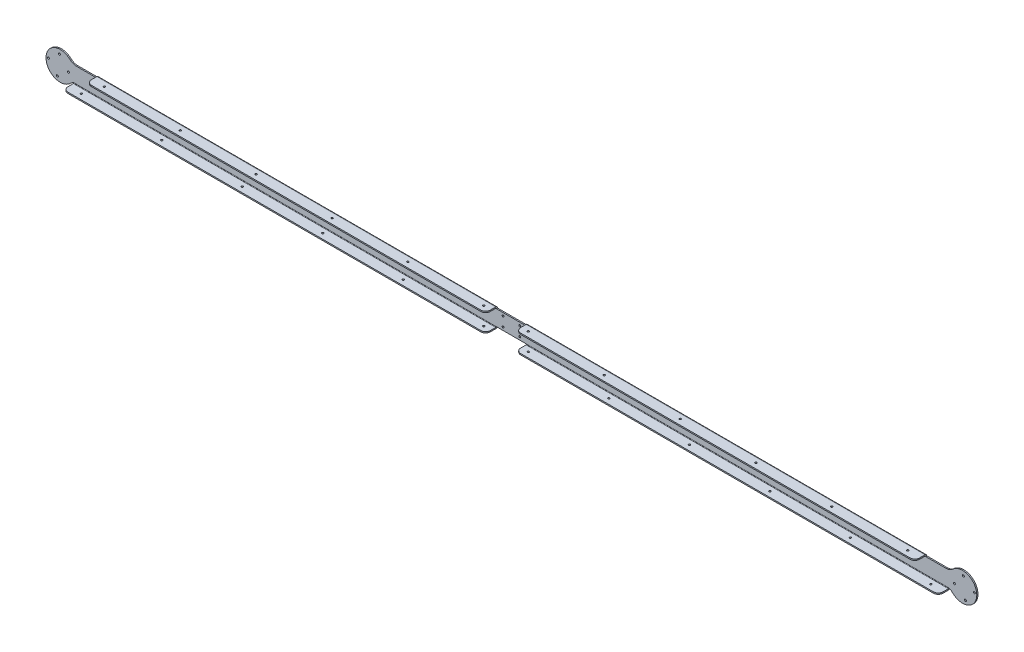
from build123d import *

# Parameters (mm, degrees)
SKETCH1_W                        = 2413
SKETCH1_H                        = 41.5544
BASE_FLANGE1_DEPTH               = 3.2639
SKETCH66_R                       = 38.1
BOSS_EXTRUDE1_DEPTH              = 3.2639
EDGE_FLANGE1_DEPTH               = 1129.41735
EDGE_FLANGE1_BEND_DEPTH          = 1066.86985
EDGE_FLANGE1_BEND_2_DEPTH        = 1066.86985
EDGE_FLANGE1_BEND_3_DEPTH        = 1129.41735
F_10_0_1935_DIAMETER_HOLE1_D     = 4.9149
F_10_0_1935_DIAMETER_HOLE1_DEPTH = 3.2649
LPATTERN1_COUNT                  = 6
LPATTERN1_PITCH                  = 215.265
F_10_0_1935_DIAMETER_HOLE2_D     = 4.9149
LPATTERN2_START                  = 22.0472
LPATTERN2_OUTLINE_R              = 2.45745
LPATTERN2_DEPTH                  = 3.2639
MIRROR1_COPY_1_D                 = 4.9149
MIRROR1_COPY_1_DEPTH             = 3.2649
MIRROR1_COPY_2_D                 = 4.9149
MIRROR1_COPY_2_DEPTH             = 3.2649
MIRROR1_COPY_3_D                 = 4.9149
MIRROR1_COPY_3_DEPTH             = 3.2649
MIRROR1_COPY_4_D                 = 4.9149
MIRROR1_COPY_4_DEPTH             = 3.2649
MIRROR1_COPY_5_D                 = 4.9149
MIRROR1_COPY_5_DEPTH             = 3.2649
F_10_0_1935_DIAMETER_HOLE4_D     = 4.9149
F_3_16_0_205_DOWEL_HOLE1_D       = 5.207
FILLET1_R                        = 25.4
FILLET2_R                        = 12.7


# Read off the part's stored shape, not the designer's step: LPattern2
# Sheet-metal steps are written as plain solids
with BuildPart() as part:
    # Sketch1 → Base-Flange1 (new body)
    with BuildSketch(Plane.XY):
        Rectangle(SKETCH1_W, SKETCH1_H)
    extrude(amount=-BASE_FLANGE1_DEPTH)

    # Sketch66 → Boss-Extrude1 (add, through all)
    with BuildSketch(Plane(origin=(0, 0, -3.2639), x_dir=(-1, 0, 0), z_dir=(0, 0, -1))):
        with Locations((-1206.5, 0)):
            Circle(SKETCH66_R)
        with Locations((1206.5, 0)):
            Circle(SKETCH66_R)
    extrude(amount=-BOSS_EXTRUDE1_DEPTH)

    # Edge-Flange1 section (across the edge) → Edge-Flange1 (add)
    with BuildSketch(Plane(origin=(-1169.9875, -22.0472, 0), x_dir=(0, 1, 0), z_dir=(1, 0, 0))):
        with BuildLine():
            Line((-3.2639, 1.27), (-3.2639, 28.4861))
            Line((-3.2639, 28.4861), (0, 28.4861))
            Line((0, 28.4861), (0, 1.27))
            ThreePointArc((0, 1.27), (0.371974388, 0.371974388), (1.27, 0))
            Line((1.27, 0), (1.27, -3.2639))
            ThreePointArc((1.27, -3.2639), (-1.935951435, -1.935951435), (-3.2639, 1.27))
        make_face()
    extrude(amount=EDGE_FLANGE1_DEPTH)

    # Edge-Flange1 section 2 (across the edge) → Edge-Flange1 bend (add)
    with BuildSketch(Plane(origin=(-40.57015, 22.0472, 0), x_dir=(0, -1, 0), z_dir=(-1, 0, 0))):
        with BuildLine():
            Line((-3.2639, 1.27), (-3.2639, 28.4861))
            Line((-3.2639, 28.4861), (0, 28.4861))
            Line((0, 28.4861), (0, 1.27))
            ThreePointArc((0, 1.27), (0.371974388, 0.371974388), (1.27, 0))
            Line((1.27, 0), (1.27, -3.2639))
            ThreePointArc((1.27, -3.2639), (-1.935951435, -1.935951435), (-3.2639, 1.27))
        make_face()
    extrude(amount=EDGE_FLANGE1_BEND_DEPTH)

    # Edge-Flange1 section 3 (across the edge) → Edge-Flange1 bend 2 (add)
    with BuildSketch(Plane(origin=(1107.44, 22.0472, 0), x_dir=(0, -1, 0), z_dir=(-1, 0, 0))):
        with BuildLine():
            Line((-3.2639, 1.27), (-3.2639, 28.4861))
            Line((-3.2639, 28.4861), (0, 28.4861))
            Line((0, 28.4861), (0, 1.27))
            ThreePointArc((0, 1.27), (0.371974388, 0.371974388), (1.27, 0))
            Line((1.27, 0), (1.27, -3.2639))
            ThreePointArc((1.27, -3.2639), (-1.935951435, -1.935951435), (-3.2639, 1.27))
        make_face()
    extrude(amount=EDGE_FLANGE1_BEND_2_DEPTH)

    # Edge-Flange1 section 4 (across the edge) → Edge-Flange1 bend 3 (add)
    with BuildSketch(Plane(origin=(40.57015, -22.0472, 0), x_dir=(0, 1, 0), z_dir=(1, 0, 0))):
        with BuildLine():
            Line((-3.2639, 1.27), (-3.2639, 28.4861))
            Line((-3.2639, 28.4861), (0, 28.4861))
            Line((0, 28.4861), (0, 1.27))
            ThreePointArc((0, 1.27), (0.371974388, 0.371974388), (1.27, 0))
            Line((1.27, 0), (1.27, -3.2639))
            ThreePointArc((1.27, -3.2639), (-1.935951435, -1.935951435), (-3.2639, 1.27))
        make_face()
    extrude(amount=EDGE_FLANGE1_BEND_3_DEPTH)

    # #10 (0.1935) Diameter Hole1
    with Locations(Plane(origin=(0, -25.3111, 0), x_dir=(-1, 0, 0), z_dir=(0, -1, 0))):
        with Locations((59.62015, -14.2875)):
            f_10_0_1935_diameter_hole1 = Hole(F_10_0_1935_DIAMETER_HOLE1_D / 2, depth=F_10_0_1935_DIAMETER_HOLE1_DEPTH)

    # LPattern1: #10 (0.1935) Diameter Hole1 ×6
    with Locations(*[(-i * LPATTERN1_PITCH, 0, 0) for i in range(1, LPATTERN1_COUNT)]):
        add(f_10_0_1935_diameter_hole1, mode=Mode.SUBTRACT)

    # #10 (0.1935) Diameter Hole2 (through all)
    with Locations(Plane(origin=(0, 25.3111, 0), x_dir=(1, 0, 0), z_dir=(0, 1, 0))):
        with Locations((-59.62015, -14.2875)):
            f_10_0_1935_diameter_hole2 = Hole(F_10_0_1935_DIAMETER_HOLE2_D / 2)

    # LPattern2 outline → LPattern2 (cut)
    with BuildSketch(Plane(origin=(0, 0, 0), x_dir=(1, 0, 0), z_dir=(0, 1, 0)).offset(LPATTERN2_START)):
        with Locations((-1074.03265, -14.2875)):
            Circle(LPATTERN2_OUTLINE_R)
        with Locations((-871.15015, -14.2875)):
            Circle(LPATTERN2_OUTLINE_R)
        with Locations((-668.26765, -14.2875)):
            Circle(LPATTERN2_OUTLINE_R)
        with Locations((-465.38515, -14.2875)):
            Circle(LPATTERN2_OUTLINE_R)
        with Locations((-262.50265, -14.2875)):
            Circle(LPATTERN2_OUTLINE_R)
    lpattern2 = extrude(amount=LPATTERN2_DEPTH, mode=Mode.SUBTRACT)

    # Mirror1: #10 (0.1935) Diameter Hole1, #10 (0.1935) Diameter Hole2, LPattern2 across plane
    add(f_10_0_1935_diameter_hole1.mirror(Plane(origin=(0, 0, 0), x_dir=(0, 0, 1), z_dir=(1, 0, 0))), mode=Mode.SUBTRACT)
    add(f_10_0_1935_diameter_hole2.mirror(Plane(origin=(0, 0, 0), x_dir=(0, 0, 1), z_dir=(1, 0, 0))), mode=Mode.SUBTRACT)
    add(lpattern2.mirror(Plane(origin=(0, 0, 0), x_dir=(0, 0, 1), z_dir=(1, 0, 0))), mode=Mode.SUBTRACT)

    # Mirror1 copy 1
    with Locations(Plane(origin=(215.265, -25.3111, 0), x_dir=(1, 0, 0), z_dir=(0, -1, 0))):
        with Locations((59.62015, 14.2875)):
            Hole(MIRROR1_COPY_1_D / 2, depth=MIRROR1_COPY_1_DEPTH)

    # Mirror1 copy 2
    with Locations(Plane(origin=(430.53, -25.3111, 0), x_dir=(1, 0, 0), z_dir=(0, -1, 0))):
        with Locations((59.62015, 14.2875)):
            Hole(MIRROR1_COPY_2_D / 2, depth=MIRROR1_COPY_2_DEPTH)

    # Mirror1 copy 3
    with Locations(Plane(origin=(645.795, -25.3111, 0), x_dir=(1, 0, 0), z_dir=(0, -1, 0))):
        with Locations((59.62015, 14.2875)):
            Hole(MIRROR1_COPY_3_D / 2, depth=MIRROR1_COPY_3_DEPTH)

    # Mirror1 copy 4
    with Locations(Plane(origin=(861.06, -25.3111, 0), x_dir=(1, 0, 0), z_dir=(0, -1, 0))):
        with Locations((59.62015, 14.2875)):
            Hole(MIRROR1_COPY_4_D / 2, depth=MIRROR1_COPY_4_DEPTH)

    # Mirror1 copy 5
    with Locations(Plane(origin=(1076.325, -25.3111, 0), x_dir=(1, 0, 0), z_dir=(0, -1, 0))):
        with Locations((59.62015, 14.2875)):
            Hole(MIRROR1_COPY_5_D / 2, depth=MIRROR1_COPY_5_DEPTH)

    # #10 (0.1935) Diameter Hole4 (through all)
    with Locations(Plane(origin=(0, 0, -3.2639), x_dir=(-1, 0, 0), z_dir=(0, 0, -1))):
        with Locations((-22.225, 12.7), (-22.225, -12.7), (22.225, -12.7), (22.225, 12.7)):
            Hole(F_10_0_1935_DIAMETER_HOLE4_D / 2)

    # 3/16 (0.205) Dowel Hole1 (through all)
    with Locations(Plane(origin=(0, 0, -3.2639), x_dir=(-1, 0, 0), z_dir=(0, 0, -1))):
        with Locations((-1208.653632912, 26.310584015), (-1184.676526013, -3.298677116), (-1214.285787144, -27.275784015), (-1238.262894043, 2.333477116)):
            f_3_16_0_205_dowel_hole1 = Hole(F_3_16_0_205_DOWEL_HOLE1_D / 2)

    # Mirror2: 3/16 (0.205) Dowel Hole1 across plane
    add(f_3_16_0_205_dowel_hole1.mirror(Plane(origin=(0, 0, 0), x_dir=(0, 0, 1), z_dir=(1, 0, 0))), mode=Mode.SUBTRACT)

    # Fillet1
    # the kernel refuses this fillet: 25.4 mm, written as the material it adds along each edge
    with BuildSketch(Plane(origin=(1174.563845564, -20.7772, 0), x_dir=(0.6276468815882087, -0.778498164437526, 0), z_dir=(0, 0, -1))) as fillet1_piece_1:
        with BuildLine():
            CenterArc((10.318975145, 25.268654931), FILLET1_R, 238.711829653, 25.458889439)
            Line((-2.872329022, 3.562676621), (-3.136155106, 3.128557055))
            ThreePointArc((-3.136155106, 3.128557055), (-1.831641579, 1.462493695), (-0.395477068, -0.318844616))
            Line((-0.395477068, -0.318844616), (0.051594876, -0.505373099))
            ThreePointArc((0.051594876, -0.505373099), (3.86961568, -0.310982396), (7.687636483, -0.505373099))
            Line((7.687636483, -0.505373099), (7.739231359, 0))
        make_face()
    extrude(amount=3.2639)
    with BuildSketch(Plane(origin=(1174.563845564, 20.7772, 0), x_dir=(0.640777338935112, 0.7677267755570576, 0), z_dir=(0, 0, -1))) as fillet1_piece_2:
        with BuildLine():
            CenterArc((12.034003451, -25.221199864), FILLET1_R, 96.802362748, 43.347829096)
            Line((-7.466256648, -8.945455455), (-7.85626185, -8.619940566))
            Line((-7.85626185, -8.619940566), (-0.390005202, 0.325514888))
            Line((-0.390005202, 0.325514888), (0.060170017, 0.504423997))
            ThreePointArc((0.060170017, 0.504423997), (4.512751294, 0.239799795), (8.965332571, 0.504423997))
            Line((8.965332571, 0.504423997), (9.025502588, 0))
        make_face()
    extrude(amount=3.2639)
    with BuildSketch(Plane(origin=(-1174.563845564, 20.7772, 0), x_dir=(1, 0, 0), z_dir=(0, 0, -1))) as fillet1_piece_3:
        with BuildLine():
            CenterArc((11.651873739, -25.4), FILLET1_R, 90, 43.347829096)
            Line((-5.783337531, -6.92912), (-6.132041757, -6.5597024))
            ThreePointArc((-6.132041757, -6.5597024), (-3.075769489, -3.310901725), (-0.425815392, 0.277029333))
            Line((-0.425815392, 0.277029333), (0, 0.508))
            Line((0, 0.508), (11.651873739, 0.508))
            Line((11.651873739, 0.508), (11.651873739, 0))
        make_face()
    extrude(amount=3.2639)
    with BuildSketch(Plane(origin=(-1174.563845564, -20.7772, 0), x_dir=(1, 0, 0), z_dir=(0, 0, -1))) as fillet1_piece_4:
        with BuildLine():
            CenterArc((13.19492891, 23.893095679), FILLET1_R, 224.706007222, 25.458889439)
            Line((-4.857504428, 6.024977407), (-5.218553095, 5.667615042))
            ThreePointArc((-5.218553095, 5.667615042), (-2.670851438, 2.817301573), (-0.425815392, -0.277029333))
            Line((-0.425815392, -0.277029333), (0, -0.508))
            ThreePointArc((0, -0.508), (2.288172782, -0.508), (4.403973897, -0.477861914))
            Line((4.403973897, -0.477861914), (4.576345564, 0))
        make_face()
    extrude(amount=3.2639)

    # Fillet2
    fillet2_edges = [part.edges().sort_by_distance(p)[0] for p in [
        (1107.44, 23.67915, 28.4861),
        (40.57015, 23.67915, 28.4861),
        (40.57015, -23.67915, 28.4861),
        (1169.9875, -23.67915, 28.4861),
        (-1169.9875, -23.67915, 28.4861),
        (-40.57015, -23.67915, 28.4861),
        (-40.57015, 23.67915, 28.4861),
        (-1107.44, 23.67915, 28.4861),
    ]]
    fillet(fillet2_edges, radius=FILLET2_R)


solid = part.part
